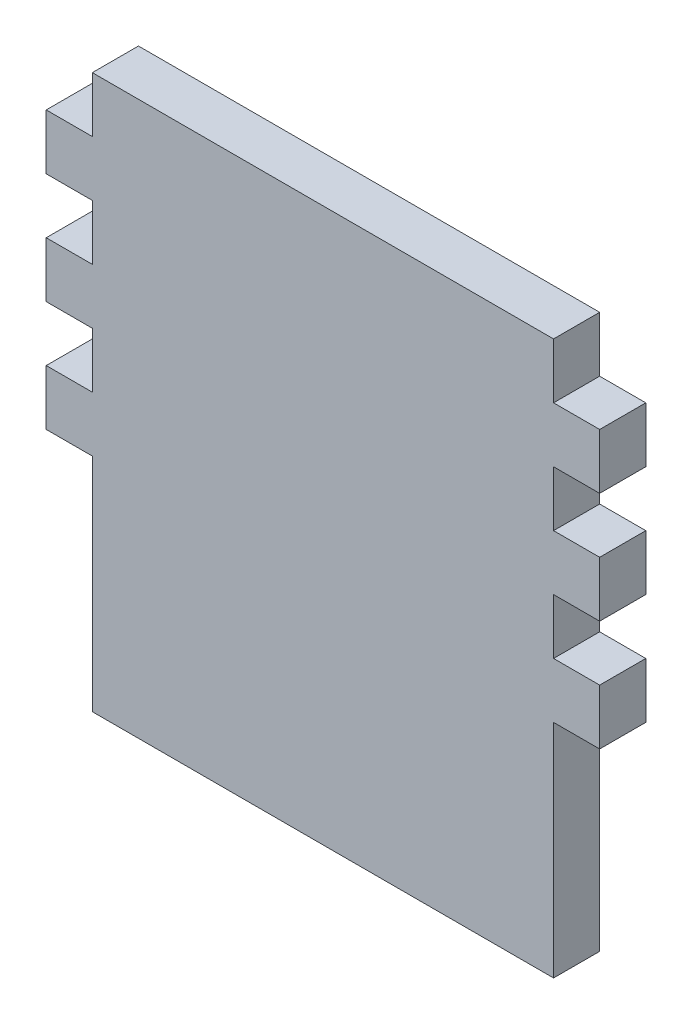
from build123d import *

# Parameters (mm, degrees)
SKETCH1_W           = 76.2
SKETCH1_H           = 76.2
BOSS_EXTRUDE1_DEPTH = 6.35
CUT_EXTRUDE1_DEPTH  = 6.35
SKETCH3_W           = 6.35
SKETCH3_H           = 38.1
CUT_EXTRUDE2_DEPTH  = 6.35
SKETCH4_W           = 6.35
SKETCH4_H           = 7.62
BOSS_EXTRUDE3_DEPTH = 6.35


with BuildPart() as part:
    # Sketch1 → Boss-Extrude1 (new body)
    with BuildSketch(Plane.XY):
        with Locations((0.21991342, -21.056709957)):
            Rectangle(SKETCH1_W, SKETCH1_H)
    extrude(amount=BOSS_EXTRUDE1_DEPTH)

    # Sketch2 → Cut-Extrude1 (cut)
    with BuildSketch(Plane.XY.offset(6.35)):
        Polygon((-37.88008658, 17.043290043), (-31.53008658, 17.043290043), (-31.53008658, 9.423290043), (-37.88008658, 9.423290043), (-37.88008658, 1.803290043), (-31.53008658, 1.803290043), (-31.53008658, -5.816709957), (-37.88008658, -5.816709957), (-37.88008658, -13.436709957), (-31.53008658, -13.436709957), (-31.53008658, -21.056709957), (-37.88008658, -21.056709957), (-46.725849744, -21.056709957), (-46.725849744, 17.043290043), align=None)
        Polygon((47.165676584, -21.056709957), (47.165676584, 17.043290043), (38.31991342, 17.043290043), (31.96991342, 17.043290043), (31.96991342, 9.423290043), (38.31991342, 9.423290043), (38.31991342, 1.803290043), (31.96991342, 1.803290043), (31.96991342, -5.816709957), (38.31991342, -5.816709957), (38.31991342, -13.436709957), (31.96991342, -13.436709957), (31.96991342, -21.056709957), (38.31991342, -21.056709957), align=None)
    extrude(amount=-CUT_EXTRUDE1_DEPTH, mode=Mode.SUBTRACT)

    # Sketch3 → Cut-Extrude2 (cut)
    with BuildSketch(Plane.XY.offset(6.35)):
        with Locations((-34.70508658, -40.106709957)):
            Rectangle(SKETCH3_W, SKETCH3_H)
        with Locations((35.14491342, -40.106709957)):
            Rectangle(SKETCH3_W, SKETCH3_H)
    extrude(amount=-CUT_EXTRUDE2_DEPTH, mode=Mode.SUBTRACT)

    # Sketch4 → Boss-Extrude3 (add)
    with BuildSketch(Plane.XY.offset(6.35)):
        with Locations((-34.70508658, -24.866709957)):
            Rectangle(SKETCH4_W, SKETCH4_H)
        with Locations((35.14491342, -24.866709957)):
            Rectangle(SKETCH4_W, SKETCH4_H)
    extrude(amount=-BOSS_EXTRUDE3_DEPTH)


solid = part.part
